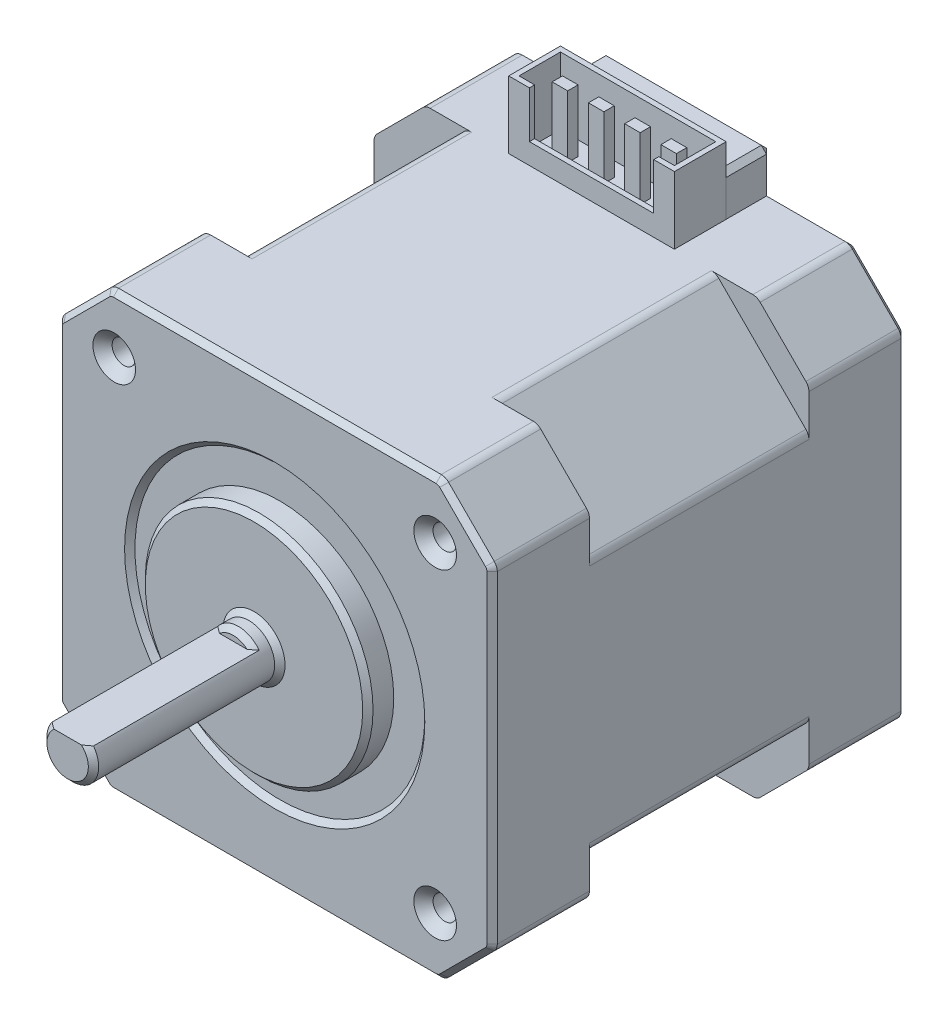
from build123d import *

# Parameters (mm, degrees)
SKETCH1_W               = 42
SKETCH1_H               = 42
BOSS_EXTRUDE1_DEPTH     = 9.4
CHAMFER1_SIZE           = 5
BOSS_EXTRUDE3_DEPTH     = 21.2
BOSS_EXTRUDE6_DEPTH     = 9.4
SKETCH6_W               = 16
SKETCH6_H               = 4
BOSS_EXTRUDE7_DEPTH     = 4.4
SKETCH7_W               = 16.005281852
SKETCH7_H               = 4.99851403
SKETCH7_W_2             = 15.005281852
SKETCH7_H_2             = 3.99851403
BOSS_EXTRUDE8_DEPTH     = 6.5
CUT_EXTRUDE1_DEPTH      = 0.5
SKETCH9_W               = 1.5
SKETCH9_H               = 1
BOSS_EXTRUDE9_DEPTH     = 6
SKETCH10_R              = 11
BOSS_EXTRUDE10_DEPTH    = 2
SKETCH11_R              = 2.5
BOSS_EXTRUDE11_DEPTH    = 18
CUT_EXTRUDE3_DEPTH      = 70.262183044
CUT_EXTRUDE3_DEPTH_BACK = 16
CUT_EXTRUDE4_START      = -0.5
SKETCH13_R              = 14
SKETCH13_R_2            = 11
CUT_EXTRUDE4_DEPTH      = 0.5
CIRPATTERN2_COUNT       = 4
CHAMFER3_SIZE           = 0.5
FILLET1_R               = 1
CHAMFER4_SIZE           = 0.5


with BuildPart() as part:
    # Sketch1 → Boss-Extrude1 (new body)
    with BuildSketch(Plane.XY):
        Rectangle(SKETCH1_W, SKETCH1_H)
    extrude(amount=BOSS_EXTRUDE1_DEPTH)

    # Chamfer1
    chamfer1_edges = [part.edges().sort_by_distance(p)[0] for p in [
        (-21, 21, 4.7),
        (21, 21, 4.7),
        (21, -21, 4.7),
        (-21, -21, 4.7),
    ]]
    chamfer(chamfer1_edges, length=CHAMFER1_SIZE)

    # Sketch3 → Boss-Extrude3 (add)
    with BuildSketch(Plane.XY.offset(9.4)):
        Polygon((-12, 21), (-21, 12), (-21, -12), (-12, -21), (12, -21), (21, -12), (21, 12), (12, 21), align=None)
    extrude(amount=BOSS_EXTRUDE3_DEPTH)

    # Sketch5 → Boss-Extrude6 (add)
    with BuildSketch(Plane.XY.offset(30.6)):
        Polygon((21, 12), (12, 21), (-12, 21), (-21, 12), (-21, -12), (-12, -21), (12, -21), (21, -12), align=None)
        Polygon((-12, 21), (-16, 21), (-21, 16), (-21, 12), align=None)
        Polygon((16, 21), (12, 21), (21, 12), (21, 16), align=None)
        Polygon((21, -16), (21, -12), (12, -21), (16, -21), align=None)
        Polygon((-12, -21), (-21, -12), (-21, -16), (-16, -21), align=None)
    extrude(amount=BOSS_EXTRUDE6_DEPTH)

    # Sketch6 → Boss-Extrude7 (add)
    with BuildSketch(Plane(origin=(0, 0, 0), x_dir=(-1, 0, 0), z_dir=(0, 0, -1))):
        with Locations((-0.000479461, 23)):
            Rectangle(SKETCH6_W, SKETCH6_H)
    extrude(amount=-BOSS_EXTRUDE7_DEPTH)

    # Sketch7 → Boss-Extrude8 (add)
    with BuildSketch(Plane(origin=(0, 21, 0), x_dir=(1, 0, 0), z_dir=(0, 1, 0))):
        with Locations((0.003120387, -6.899257015)):
            Rectangle(SKETCH7_W, SKETCH7_H)
        with Locations((0.003120387, -6.899257015)):
            Rectangle(SKETCH7_W_2, SKETCH7_H_2, mode=Mode.SUBTRACT)
    extrude(amount=BOSS_EXTRUDE8_DEPTH)

    # Sketch8 → Cut-Extrude1 (cut)
    with BuildSketch(Plane.XY.offset(9.39851403)):
        Polygon((-5.999520539, 25.5), (-5.999520539, 29.381183142), (6.005761313, 29.381183142), (6.005761313, 25.5), (6.005761313, 23), (-5.999520539, 23), align=None)
    extrude(amount=-CUT_EXTRUDE1_DEPTH, mode=Mode.SUBTRACT)

    # Sketch9 → Boss-Extrude9 (add)
    with BuildSketch(Plane(origin=(0, 21, 0), x_dir=(1, 0, 0), z_dir=(0, 1, 0))):
        with Locations((-5.149520539, -6.8)):
            Rectangle(SKETCH9_W, SKETCH9_H)
        with Locations((-1.649520539, -6.8)):
            Rectangle(SKETCH9_W, SKETCH9_H)
        with Locations((1.850479461, -6.8)):
            Rectangle(SKETCH9_W, SKETCH9_H)
        with Locations((5.350479461, -6.8)):
            Rectangle(SKETCH9_W, SKETCH9_H)
    extrude(amount=BOSS_EXTRUDE9_DEPTH)

    # Sketch10 → Boss-Extrude10 (add)
    with BuildSketch(Plane.XY.offset(40)):
        Circle(SKETCH10_R)
    extrude(amount=BOSS_EXTRUDE10_DEPTH)

    # Sketch11 → Boss-Extrude11 (add)
    with BuildSketch(Plane.XY.offset(42)):
        Circle(SKETCH11_R)
    extrude(amount=BOSS_EXTRUDE11_DEPTH)

    # Sketch12 → Cut-Extrude3 (cut, two sides: drawn at the far end of the back side and taken through both)
    with BuildSketch(Plane.XY.offset(60).offset(-CUT_EXTRUDE3_DEPTH_BACK)):
        Polygon((-81.426219831, 1.5), (-2, 1.5), (2, 1.5), (81.426219831, 1.5), (81.426219831, 160.352439662), (-81.426219831, 160.352439662), align=None)
    extrude(amount=CUT_EXTRUDE3_DEPTH + CUT_EXTRUDE3_DEPTH_BACK, mode=Mode.SUBTRACT)

    # Sketch13 → Cut-Extrude4 (cut)
    with BuildSketch(Plane.XY.offset(40).offset(CUT_EXTRUDE4_START)):
        Circle(SKETCH13_R)
        Circle(SKETCH13_R_2, mode=Mode.SUBTRACT)
    extrude(amount=CUT_EXTRUDE4_DEPTH, mode=Mode.SUBTRACT)

    # Sketch15 → #4-40 Tapped Hole1 (revolve, cut)
    with BuildSketch(Plane(origin=(-15.5, 15.5, 40), x_dir=(0, -1, 0), z_dir=(1, 0, 0))):
        Polygon((0, 0), (0, 9.179152758), (1.1303, 8.5), (1.1303, 0.9271), (2.0574, 0), align=None)
    f_4_40_tapped_hole1 = revolve(axis=Axis((-15.5, 15.5, 46.35), (0, 0, -1)), mode=Mode.SUBTRACT)

    # CirPattern2: #4-40 Tapped Hole1 ×4 about axis
    cirpattern2_axis = Axis((0, 0, 0), (0, 0, 1))
    for i in range(1, CIRPATTERN2_COUNT):
        add(f_4_40_tapped_hole1.rotate(cirpattern2_axis, i * 360 / CIRPATTERN2_COUNT), mode=Mode.SUBTRACT)

    # Chamfer3
    chamfer3_edges = [part.edges().sort_by_distance(p)[0] for p in [
        (-11, 0, 42),
        (-2.5, 0, 42),
        (-0.790569415, -2.371708245, 60),
        (0, 2.5, 44),
        (-14, 0, 40),
    ]]
    chamfer(chamfer3_edges, length=CHAMFER3_SIZE - 0.0001)  # a hair under: the kernel refuses the full size

    # Fillet1
    fillet1_edges = [part.edges().sort_by_distance(p)[0] for p in [
        (21, 16, 4.7),
        (21, -16, 4.7),
        (-16, -21, 4.7),
        (16, -21, 4.7),
        (-21, 16, 4.7),
        (-21, -16, 4.7),
        (16, 21, 4.7),
        (-16, 21, 4.7),
        (12, 21, 20),
        (-12, 21, 20),
        (-21, 12, 20),
        (-21, -12, 20),
        (-12, -21, 20),
        (12, -21, 20),
        (21, -12, 20),
        (21, 12, 20),
        (21, -16, 35.3),
        (21, 16, 35.3),
        (16, 21, 35.3),
        (-16, 21, 35.3),
        (-21, 16, 35.3),
        (-21, -16, 35.3),
        (-16, -21, 35.3),
        (16, -21, 35.3),
    ]]
    fillet(fillet1_edges, radius=FILLET1_R)

    # Chamfer4
    chamfer4_edges = [part.edges().sort_by_distance(p)[0] for p in [
        (-11.792653488, 21, 0),
        (8.000479461, 25, 2.2),
        (-7.999520539, 25, 2.2),
        (8.000479461, 23, 0),
        (0.000479461, 25, 0),
        (0, 21, 40),
        (11.79313295, 21, 0),
        (-18.5, 18.5, 0),
        (21, 0, 0),
        (18.5, -18.5, 0),
        (0, -21, 0),
        (-18.5, -18.5, 0),
        (-21, 0, 0),
        (18.5, 18.5, 0),
        (20.923879533, 15.96846987, 0),
        (15.96846987, 20.923879533, 0),
        (20.923879533, -15.96846987, 0),
        (15.96846987, -20.923879533, 0),
        (-15.96846987, -20.923879533, 0),
        (-20.923879533, -15.96846987, 0),
        (-20.923879533, 15.96846987, 0),
        (-15.96846987, 20.923879533, 0),
        (-18.5, 18.5, 40),
        (21, 0, 40),
        (18.5, 18.5, 40),
        (-21, 0, 40),
        (-18.5, -18.5, 40),
        (0, -21, 40),
        (18.5, -18.5, 40),
        (15.96846987, 20.923879533, 40),
        (20.923879533, 15.96846987, 40),
        (20.923879533, -15.96846987, 40),
        (15.96846987, -20.923879533, 40),
        (-15.96846987, -20.923879533, 40),
        (-20.923879533, -15.96846987, 40),
        (-20.923879533, 15.96846987, 40),
        (-15.96846987, 20.923879533, 40),
    ]]
    chamfer(chamfer4_edges, length=CHAMFER4_SIZE)


solid = part.part
